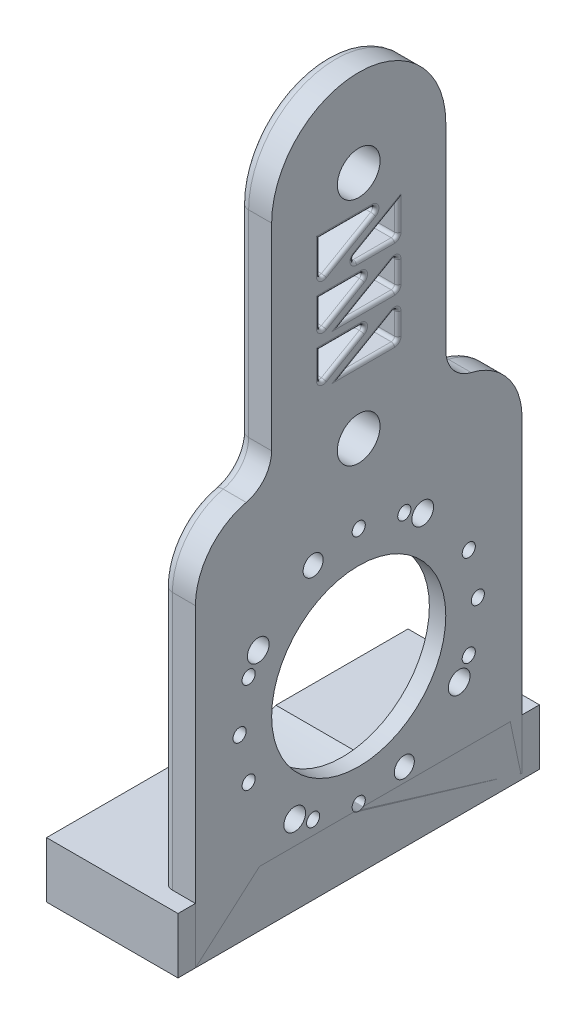
from build123d import *

# Parameters (mm, degrees)
SKETCH2_R           = 6.5
SKETCH2_R_2         = 2
SKETCH2_R_3         = 3.3
SKETCH2_R_4         = 3.05
SKETCH2_R_5         = 26.5
BOSS_EXTRUDE1_DEPTH = 5
BOSS_EXTRUDE2_START = -5
SKETCH2_5_R         = 6.5
SKETCH2_5_R_2       = 40.5
BOSS_EXTRUDE2_DEPTH = 5
BOSS_EXTRUDE3_DEPTH = 17
CUT_EXTRUDE8_START  = -50
SKETCH2_11_R        = 40.5
CUT_EXTRUDE8_DEPTH  = 50
SKETCH7_R           = 3.3
SKETCH7_R_2         = 3.05
SKETCH7_R_3         = 2
CUT_EXTRUDE9_DEPTH  = 193.138205467
CUT_EXTRUDE10_START = -10
CUT_EXTRUDE10_DEPTH = 10
FILLET1_R           = 10
FILLET2_R           = 20
FILLET3_R           = 1
FILLET4_R           = 3
CUT_EXTRUDE11_DEPTH = 10
FILLET5_R           = 1


with BuildPart() as part:
    # Sketch2 → Boss-Extrude1 (new body)
    with BuildSketch(Plane(origin=(0, 0, 0), x_dir=(0, 0, -1), z_dir=(1, 0, 0))):
        with BuildLine():
            Line((-49.7, 130), (-49.7, -54.7))
            Line((-49.7, -54.7), (49.7, -54.7))
            Line((49.7, -54.7), (49.7, 130))
            ThreePointArc((49.7, 130), (0, 179.7), (-49.7, 130))
        make_face()
        with Locations((-0.006451274, 60)):
            Circle(SKETCH2_R, mode=Mode.SUBTRACT)
        with Locations((0, 130)):
            Circle(SKETCH2_R, mode=Mode.SUBTRACT)
        with Locations((33.490633054, 13.872274423)):
            Circle(SKETCH2_R_2, mode=Mode.SUBTRACT)
        with Locations((-33.490633054, -13.872274423)):
            Circle(SKETCH2_R_2, mode=Mode.SUBTRACT)
        with Locations((-36.25, 0)):
            Circle(SKETCH2_R_2, mode=Mode.SUBTRACT)
        with Locations((-19.477110803, -30.572939911)):
            Circle(SKETCH2_R_3, mode=Mode.SUBTRACT)
        with Locations((-13.872274423, -33.490633054)):
            Circle(SKETCH2_R_2, mode=Mode.SUBTRACT)
        with Locations((-33.490633054, 13.872274423)):
            Circle(SKETCH2_R_2, mode=Mode.SUBTRACT)
        with Locations((-30.572939911, 19.477110803)):
            Circle(SKETCH2_R_3, mode=Mode.SUBTRACT)
        with Locations((-13.872274423, 33.490633054)):
            Circle(SKETCH2_R_4, mode=Mode.SUBTRACT)
        with Locations((0, 36.25)):
            Circle(SKETCH2_R_2, mode=Mode.SUBTRACT)
        with Locations((0, -36.25)):
            Circle(SKETCH2_R_2, mode=Mode.SUBTRACT)
        with Locations((13.872274423, -33.490633054)):
            Circle(SKETCH2_R_4, mode=Mode.SUBTRACT)
        Circle(SKETCH2_R_5, mode=Mode.SUBTRACT)
        with Locations((30.572939911, -19.477110803)):
            Circle(SKETCH2_R_3, mode=Mode.SUBTRACT)
        with Locations((33.490633054, -13.872274423)):
            Circle(SKETCH2_R_2, mode=Mode.SUBTRACT)
        with Locations((36.25, 0)):
            Circle(SKETCH2_R_2, mode=Mode.SUBTRACT)
        with Locations((19.477110803, 30.572939911)):
            Circle(SKETCH2_R_3, mode=Mode.SUBTRACT)
        with Locations((13.872274423, 33.490633054)):
            Circle(SKETCH2_R_2, mode=Mode.SUBTRACT)
    extrude(amount=BOSS_EXTRUDE1_DEPTH)

    # Sketch2<5> → Boss-Extrude2 (add)
    with BuildSketch(Plane(origin=(0, 0, 0), x_dir=(0, 0, -1), z_dir=(1, 0, 0)).offset(BOSS_EXTRUDE2_START)):
        with BuildLine():
            Line((-49.7, 130), (-49.7, 0))
            Line((-49.7, 0), (-49.7, -54.7))
            Line((-49.7, -54.7), (49.7, -54.7))
            Line((49.7, -54.7), (49.7, 30))
            Line((49.7, 30), (49.7, 130))
            ThreePointArc((49.7, 130), (0, 179.7), (-49.7, 130))
        make_face()
        with Locations((-0.006451274, 60)):
            Circle(SKETCH2_5_R, mode=Mode.SUBTRACT)
        Circle(SKETCH2_5_R_2, mode=Mode.SUBTRACT)
        with Locations((0, 130)):
            Circle(SKETCH2_5_R, mode=Mode.SUBTRACT)
    extrude(amount=BOSS_EXTRUDE2_DEPTH)

    # Sketch8 → Cut-Extrude10 (cut)
    with BuildSketch(Plane(origin=(5, 0, 0), x_dir=(0, 0, -1), z_dir=(1, 0, 0)).offset(CUT_EXTRUDE10_START)):
        with BuildLine():
            Line((26.5, 60), (49.7, 60))
            Line((49.7, 60), (49.7, 130))
            ThreePointArc((49.7, 130), (0, 179.7), (-49.7, 130))
            Line((-49.7, 130), (-49.7, 60.009159619))
            Line((-49.7, 60.009159619), (-26.512902097, 60.004885725))
            Line((-26.512902097, 60.004885725), (-26.49999955, 130.004884536))
            ThreePointArc((-26.49999955, 130.004884536), (0.002442268, 156.499999887), (26.5, 130))
            Line((26.5, 130), (26.5, 60))
        make_face()
    extrude(amount=CUT_EXTRUDE10_DEPTH, mode=Mode.SUBTRACT)

    # Fillet1
    fillet1_edges = [part.edges().sort_by_distance(p)[0] for p in [
        (0, 60.004885725, 26.512902097),
        (0, 60, -26.5),
    ]]
    fillet(fillet1_edges, radius=FILLET1_R)

    # Fillet2
    fillet2_edges = [part.edges().sort_by_distance(p)[0] for p in [
        (0, 60.009159619, 49.7),
        (0, 60, -49.7),
    ]]
    fillet(fillet2_edges, radius=FILLET2_R)

    # Fillet3
    fillet3_edges = [part.edges().sort_by_distance(p)[0] for p in [
        (-5, 0, 40.5),
    ]]
    fillet(fillet3_edges, radius=FILLET3_R)

    # Fillet4
    fillet4_edges = [part.edges().sort_by_distance(p)[0] for p in [
        (-5, -6.959585894, -49.7),
        (-5, 53.217333616, -45.363120166),
        (-5, 63.781747298, -28.668439917),
        (-5, 100, -26.5),
        (-5, -6.95493359, 49.7),
        (-5, 53.223673826, 45.365473438),
        (-5, 63.789236426, 28.678894964),
        (-5, 100.004885045, 26.505529213),
        (-5, 156.499999887, -0.002442268),
    ]]
    fillet(fillet4_edges, radius=FILLET4_R)

    # Sketch9 → Cut-Extrude11 (cut)
    with BuildSketch(Plane.ZY.offset(5)):
        Polygon((11.876221569, 118.683117188), (-7.876221569, 118.683117188), (11.876221569, 107.279038825), align=None)
        Polygon((4.412119954, 106.969637748), (-11.876221569, 116.373716111), (-11.876221569, 106.969637748), align=None)
        Polygon((11.876221569, 93.565559385), (11.876221569, 102.969637748), (-4.412119954, 102.969637748), align=None)
        Polygon((4.412119954, 93.256158309), (-11.876221569, 102.660236672), (-11.876221569, 93.256158309), align=None)
        Polygon((11.876221569, 79.852079945), (11.876221569, 89.256158309), (-4.412119954, 89.256158309), align=None)
        Polygon((4.412119954, 79.542678869), (-11.876221569, 88.946757232), (-11.876221569, 79.542678869), align=None)
    extrude(amount=-CUT_EXTRUDE11_DEPTH, mode=Mode.SUBTRACT)

    # Fillet5
    fillet5_edges = [part.edges().sort_by_distance(p)[0] for p in [
        (5, 118.683117188, 2),
        (-5, 118.683117188, 2),
        (5, 112.981078007, 11.876221569),
        (-5, 112.981078007, 11.876221569),
        (5, 111.67167693, -11.876221569),
        (-5, 111.67167693, -11.876221569),
        (5, 111.67167693, -3.732050808),
        (-5, 111.67167693, -3.732050808),
        (5, 102.969637748, 3.732050808),
        (-5, 102.969637748, 3.732050808),
        (5, 98.267598567, 11.876221569),
        (-5, 98.267598567, 11.876221569),
        (5, 89.256158309, 3.732050808),
        (-5, 89.256158309, 3.732050808),
        (5, 84.554119127, 11.876221569),
        (-5, 84.554119127, 11.876221569),
        (5, 97.95819749, -3.732050808),
        (-5, 97.95819749, -3.732050808),
        (5, 93.256158309, -3.732050808),
        (-5, 93.256158309, -3.732050808),
        (5, 84.24471805, -3.732050808),
        (-5, 84.24471805, -3.732050808),
        (5, 79.542678869, -3.732050808),
        (-5, 79.542678869, -3.732050808),
        (0, 118.683117188, -7.876221569),
        (5, 112.981078007, 2),
        (0, 107.279038825, 11.876221569),
        (-5, 112.981078007, 2),
        (0, 106.969637748, -11.876221569),
        (5, 106.969637748, -3.732050808),
        (0, 106.969637748, 4.412119954),
        (-5, 106.969637748, -3.732050808),
        (0, 102.969637748, -4.412119954),
        (5, 98.267598567, 3.732050808),
        (0, 93.565559385, 11.876221569),
        (-5, 98.267598567, 3.732050808),
        (0, 89.256158309, -4.412119954),
        (5, 84.554119127, 3.732050808),
        (0, 79.852079945, 11.876221569),
        (-5, 84.554119127, 3.732050808),
        (0, 102.660236672, -11.876221569),
        (5, 97.95819749, -11.876221569),
        (0, 93.256158309, -11.876221569),
        (-5, 97.95819749, -11.876221569),
        (0, 88.946757232, -11.876221569),
        (5, 84.24471805, -11.876221569),
        (0, 79.542678869, -11.876221569),
        (-5, 84.24471805, -11.876221569),
    ]]
    fillet(fillet5_edges, radius=FILLET5_R)


with BuildPart() as body_2:
    # Sketch3 → Boss-Extrude3 (new body)
    with BuildSketch(Plane(origin=(0, -54.7, 0), x_dir=(-1, 0, 0), z_dir=(0, -1, 0))):
        Polygon((-5, 55), (35, 55), (35, 0), (35, -55), (-5, -55), align=None)
    extrude(amount=-BOSS_EXTRUDE3_DEPTH)

    # Sketch2<11> → Cut-Extrude8 (cut)
    with BuildSketch(Plane(origin=(0, 0, 0), x_dir=(0, 0, -1), z_dir=(1, 0, 0)).offset(CUT_EXTRUDE8_START)):
        Circle(SKETCH2_11_R)
        with BuildLine():
            ThreePointArc((-32.076419491, -12.458060861), (-32.076419491, -15.286487986), (-34.904846616, -15.286487986))
            ThreePointArc((-34.904846616, -15.286487986), (-34.904846616, -12.458060861), (-32.076419491, -12.458060861))
        make_face(mode=Mode.SUBTRACT)
        with BuildLine():
            ThreePointArc((-34.835786438, 1.414213562), (-34.835786438, -1.414213562), (-37.664213562, -1.414213562))
            ThreePointArc((-37.664213562, -1.414213562), (-37.664213562, 1.414213562), (-34.835786438, 1.414213562))
        make_face(mode=Mode.SUBTRACT)
        with BuildLine():
            ThreePointArc((-21.81056318, -32.906392289), (-21.81056318, -28.239487533), (-17.143658425, -28.239487533))
            ThreePointArc((-17.143658425, -28.239487533), (-17.143658425, -32.906392289), (-21.81056318, -32.906392289))
        make_face(mode=Mode.SUBTRACT)
        with BuildLine():
            ThreePointArc((-15.286487986, -34.904846616), (-15.286487986, -32.076419491), (-12.458060861, -32.076419491))
            ThreePointArc((-12.458060861, -32.076419491), (-12.458060861, -34.904846616), (-15.286487986, -34.904846616))
        make_face(mode=Mode.SUBTRACT)
        with BuildLine():
            ThreePointArc((-34.904846616, 12.458060861), (-34.904846616, 15.286487986), (-32.076419491, 15.286487986))
            ThreePointArc((-32.076419491, 15.286487986), (-32.076419491, 12.458060861), (-34.904846616, 12.458060861))
        make_face(mode=Mode.SUBTRACT)
        with BuildLine():
            ThreePointArc((-32.906392289, 17.143658425), (-32.906392289, 21.81056318), (-28.239487533, 21.81056318))
            ThreePointArc((-28.239487533, 21.81056318), (-28.239487533, 17.143658425), (-32.906392289, 17.143658425))
        make_face(mode=Mode.SUBTRACT)
        with BuildLine():
            ThreePointArc((-11.715598741, 35.647308736), (-11.715598741, 31.333957371), (-16.028950106, 31.333957371))
            ThreePointArc((-16.028950106, 31.333957371), (-16.028950106, 35.647308736), (-11.715598741, 35.647308736))
        make_face(mode=Mode.SUBTRACT)
        with BuildLine():
            ThreePointArc((1.414213562, 37.664213562), (1.414213562, 34.835786438), (-1.414213562, 34.835786438))
            ThreePointArc((-1.414213562, 34.835786438), (-1.414213562, 37.664213562), (1.414213562, 37.664213562))
        make_face(mode=Mode.SUBTRACT)
        with BuildLine():
            ThreePointArc((1.414213562, -34.835786438), (1.414213562, -37.664213562), (-1.414213562, -37.664213562))
            ThreePointArc((-1.414213562, -37.664213562), (-1.414213562, -34.835786438), (1.414213562, -34.835786438))
        make_face(mode=Mode.SUBTRACT)
        with BuildLine():
            ThreePointArc((11.715598741, -35.647308736), (11.715598741, -31.333957371), (16.028950106, -31.333957371))
            ThreePointArc((16.028950106, -31.333957371), (16.028950106, -35.647308736), (11.715598741, -35.647308736))
        make_face(mode=Mode.SUBTRACT)
        with BuildLine():
            ThreePointArc((20.900199859, -16.292073099), (-16.292073099, -20.900199859), (-20.900199859, 16.292073099))
            ThreePointArc((-20.900199859, 16.292073099), (16.292073099, 20.900199859), (20.900199859, -16.292073099))
        make_face(mode=Mode.SUBTRACT)
        with BuildLine():
            ThreePointArc((28.239487533, -21.81056318), (28.239487533, -17.143658425), (32.906392289, -17.143658425))
            ThreePointArc((32.906392289, -17.143658425), (32.906392289, -21.81056318), (28.239487533, -21.81056318))
        make_face(mode=Mode.SUBTRACT)
        with BuildLine():
            ThreePointArc((34.904846616, -12.458060861), (34.904846616, -15.286487986), (32.076419491, -15.286487986))
            ThreePointArc((32.076419491, -15.286487986), (32.076419491, -12.458060861), (34.904846616, -12.458060861))
        make_face(mode=Mode.SUBTRACT)
        with BuildLine():
            ThreePointArc((37.664213562, 1.414213562), (37.664213562, -1.414213562), (34.835786438, -1.414213562))
            ThreePointArc((34.835786438, -1.414213562), (34.835786438, 1.414213562), (37.664213562, 1.414213562))
        make_face(mode=Mode.SUBTRACT)
        with BuildLine():
            ThreePointArc((17.143658425, 28.239487533), (17.143658425, 32.906392289), (21.81056318, 32.906392289))
            ThreePointArc((21.81056318, 32.906392289), (21.81056318, 28.239487533), (17.143658425, 28.239487533))
        make_face(mode=Mode.SUBTRACT)
        with BuildLine():
            ThreePointArc((12.458060861, 32.076419491), (12.458060861, 34.904846616), (15.286487986, 34.904846616))
            ThreePointArc((15.286487986, 34.904846616), (15.286487986, 32.076419491), (12.458060861, 32.076419491))
        make_face(mode=Mode.SUBTRACT)
        with BuildLine():
            ThreePointArc((34.904846616, 15.286487986), (34.904846616, 12.458060861), (32.076419491, 12.458060861))
            ThreePointArc((32.076419491, 12.458060861), (32.076419491, 15.286487986), (34.904846616, 15.286487986))
        make_face(mode=Mode.SUBTRACT)
    extrude(amount=CUT_EXTRUDE8_DEPTH, mode=Mode.SUBTRACT)

    # Sketch7 → Cut-Extrude9 (cut, through all)
    with BuildSketch(Plane(origin=(5, 0, 0), x_dir=(0, 0, -1), z_dir=(1, 0, 0))):
        with Locations((-19.477110803, -30.572939911)):
            Circle(SKETCH7_R)
        with Locations((13.872274423, -33.490633054)):
            Circle(SKETCH7_R_2)
        with Locations((-13.872274423, -33.490633054)):
            Circle(SKETCH7_R_3)
        with Locations((0, -36.25)):
            Circle(SKETCH7_R_3)
    extrude(amount=-CUT_EXTRUDE9_DEPTH, mode=Mode.SUBTRACT)


solid = Compound([part.part, body_2.part])
